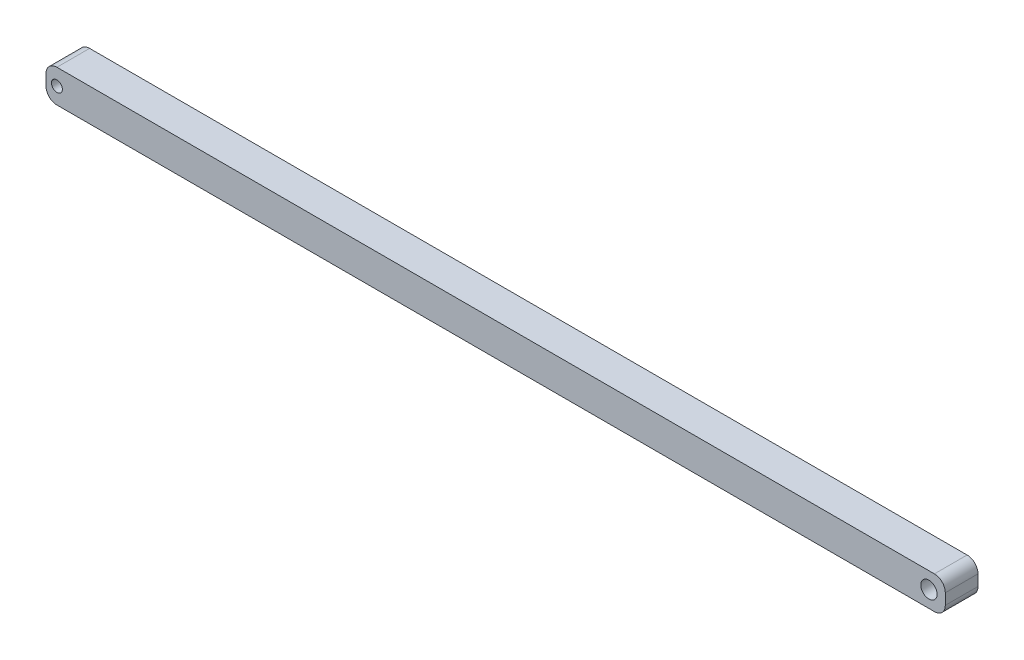
from build123d import *

# Parameters (mm, degrees)
ESQUISSE1_W             = 165
ESQUISSE1_H             = 6
BOSS_EXTRU_1_DEPTH      = 6
ESQUISSE2_R             = 1.5
ESQUISSE2_R_2           = 1
ENL_V_MAT_EXTRU_1_DEPTH = 166.218037756
CONG_1_R                = 2


with BuildPart() as part:
    # Esquisse1 → Boss.-Extru.1 (new body)
    with BuildSketch(Plane.XY):
        with Locations((82.5, 3)):
            Rectangle(ESQUISSE1_W, ESQUISSE1_H)
    extrude(amount=BOSS_EXTRU_1_DEPTH)

    # Esquisse2 → Enlèv. mat.-Extru.1 (cut, through all)
    with BuildSketch(Plane.XY.offset(6)):
        with Locations((162, 3)):
            Circle(ESQUISSE2_R)
        with Locations((2, 3)):
            Circle(ESQUISSE2_R_2)
    extrude(amount=-ENL_V_MAT_EXTRU_1_DEPTH, mode=Mode.SUBTRACT)

    # Congé1
    cong_1_edges = [part.edges().sort_by_distance(p)[0] for p in [
        (0, 0, 3),
        (0, 6, 3),
        (165, 0, 3),
        (165, 6, 3),
    ]]
    fillet(cong_1_edges, radius=CONG_1_R)


solid = part.part
